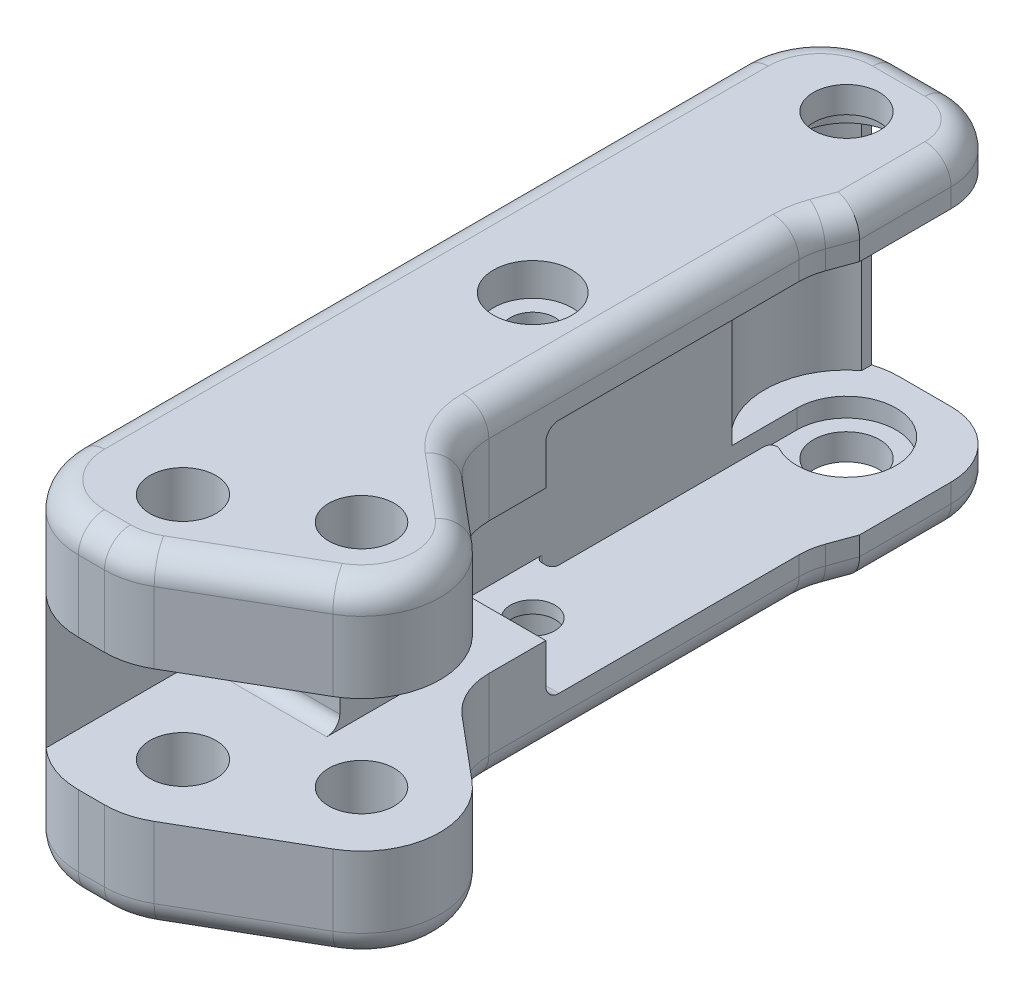
from build123d import *

# Parameters (mm, degrees)
EXTRUDE_1_DEPTH           = 7.45
EXTRUDE_2_DEPTH           = 3.45
SKETCH_3_W                = 26
SKETCH_3_H                = 4
CUT_EXTRUDE_1_DEPTH       = 9.8
SKETCH_4_W                = 4.2
SKETCH_4_H                = 62.754310162
EXTRUDE_3_DEPTH           = 5.05
CUT_EXTRUDE_2_DEPTH       = 1.45
SKETCH_6_W                = 7.8
SKETCH_6_H                = 4
EXTRUDE_4_DEPTH           = 5.05
SKETCH_7_W                = 9.8
SKETCH_7_H                = 4
CUT_EXTRUDE_3_DEPTH       = 9
CUT_EXTRUDE_4_DEPTH       = 9.05
CUT_EXTRUDE_5_REACH       = 63.678
SKETCH_10_W               = 5.05
SKETCH_10_H               = 12
SKETCH_11_W               = 14
SKETCH_11_H               = 5.05
CUT_EXTRUDE_6_DEPTH       = 2.2
HOLE_WIZARD_1_D           = 5.01
HOLE_WIZARD_2_D           = 5.05
HOLE_WIZARD_3_D           = 5.05
HOLE_WIZARD_4_D           = 3.4
HOLE_WIZARD_4_DEPTH       = 12.5
HOLE_WIZARD_4_CBORE_D     = 6
HOLE_WIZARD_4_CBORE_DEPTH = 2.5
FILLET_1_R                = 5
FILLET_2_R                = 6
FILLET_3_R                = 0.5
FILLET_4_R                = 1
FILLET_5_R                = 2


# Read off the part's stored shape, not the designer's step: 镜向2
with BuildPart() as part:
    # 草图1 → 凸台-拉伸1 (new body)
    with BuildSketch(Plane(origin=(0, 7.45, 0), x_dir=(1, 0, 0), z_dir=(0, 1, 0))):
        with BuildLine():
            Line((6, 15.064661918), (6, 56.754310162))
            Line((6, 56.754310162), (-8, 56.754310162))
            Line((-8, 56.754310162), (-8, -6))
            Line((-8, -6), (1.607695155, -6))
            Line((1.607695155, -6), (11.660254038, -0.196152423))
            ThreePointArc((11.660254038, -0.196152423), (14.637422226, 4.477065544), (12.516979696, 9.596266659))
            Line((12.516979696, 9.596266659), (6, 15.064661918))
        make_face()
    extrude(amount=-EXTRUDE_1_DEPTH)

    # 草图2 → 凸台-拉伸2 (add)
    with BuildSketch(Plane.XZ):
        Polygon((6, -42.006832742), (6, -56.754310162), (7, -56.754310162), (7, -44.754310162), align=None)
    extrude(amount=-EXTRUDE_2_DEPTH)

    # 草图3 → 切除-拉伸1 (cut)
    with BuildSketch(Plane(origin=(6, 0, 0), x_dir=(0, 0, -1), z_dir=(1, 0, 0))):
        with Locations((43.754310162, 5.45)):
            Rectangle(SKETCH_3_W, SKETCH_3_H)
    extrude(amount=-CUT_EXTRUDE_1_DEPTH, mode=Mode.SUBTRACT)

    # 草图4 → 凸台-拉伸3 (add)
    with BuildSketch(Plane(origin=(0, 7.45, 0), x_dir=(-1, 0, 0), z_dir=(0, 1, 0))):
        with Locations((5.9, -25.377155081)):
            Rectangle(SKETCH_4_W, SKETCH_4_H)
    extrude(amount=EXTRUDE_3_DEPTH)

    # 草图5 → 切除-拉伸2 (cut)
    with BuildSketch(Plane(origin=(0, 3.45, 0), x_dir=(-1, 0, 0), z_dir=(0, 1, 0))):
        with BuildLine():
            Line((3.8, -30.754310162), (2.5, -30.754310162))
            Line((2.5, -30.754310162), (2.5, -46.9477369))
            ThreePointArc((2.5, -46.9477369), (2.258573906, -47.375684951), (1.76744186, -47.390361698))
            ThreePointArc((1.76744186, -47.390361698), (-3.252405192, -52.719471851), (3.8, -50.754310162))
            Line((3.8, -50.754310162), (3.8, -30.754310162))
        make_face()
    extrude(amount=-CUT_EXTRUDE_2_DEPTH, mode=Mode.SUBTRACT)

    # 草图6 → 凸台-拉伸4 (add)
    with BuildSketch(Plane(origin=(0, 7.45, 0), x_dir=(-1, 0, 0), z_dir=(0, 1, 0))):
        with Locations((-0.1, -10)):
            Rectangle(SKETCH_6_W, SKETCH_6_H)
    extrude(amount=EXTRUDE_4_DEPTH)

    # 草图7 → 切除-拉伸3 (cut)
    with BuildSketch(Plane(origin=(0, 0, -30.754310162), x_dir=(-1, 0, 0), z_dir=(0, 0, -1))):
        with Locations((-1.1, 5.45)):
            Rectangle(SKETCH_7_W, SKETCH_7_H)
    extrude(amount=-CUT_EXTRUDE_3_DEPTH, mode=Mode.SUBTRACT)

    # 草图8 → 切除-拉伸4 (cut)
    with BuildSketch(Plane(origin=(0, 12.5, 0), x_dir=(-1, 0, 0), z_dir=(0, 1, 0))):
        with BuildLine():
            Line((3.8, -45.792203754), (3.8, -55.716416569))
            ThreePointArc((3.8, -55.716416569), (6.25, -50.754310162), (3.8, -45.792203754))
        make_face()
    extrude(amount=-CUT_EXTRUDE_4_DEPTH, mode=Mode.SUBTRACT)

    # 草图10 → 切除-拉伸5 (cut, up to next)
    with BuildSketch(Plane(origin=(-6, 0, 0), x_dir=(0, -1, 0), z_dir=(-1, 0, 0)), mode=Mode.PRIVATE) as cut_extrude_5_sk1:
        with Locations((-9.975, -18)):
            Rectangle(SKETCH_10_W, SKETCH_10_H)
    cut_extrude_5_tool1 = extrude(cut_extrude_5_sk1.sketch, amount=-CUT_EXTRUDE_5_REACH, mode=Mode.PRIVATE) & part.part
    add(cut_extrude_5_tool1.solids().sort_by_distance((-6, 9.975, -18))[0], mode=Mode.SUBTRACT)

    # 草图11 → 切除-拉伸6 (cut)
    with BuildSketch(Plane(origin=(-3.8, 0, 0), x_dir=(0, 0, -1), z_dir=(1, 0, 0))):
        with Locations((1, 9.975)):
            Rectangle(SKETCH_11_W, SKETCH_11_H)
    extrude(amount=-CUT_EXTRUDE_6_DEPTH, mode=Mode.SUBTRACT)

    # 孔1 (through all)
    with Locations(Plane(origin=(0, 7.45, 0), x_dir=(1, 0, 0), z_dir=(0, 1, 0))):
        with Locations((8.660254038, 5)):
            Hole(HOLE_WIZARD_1_D / 2)

    # 孔2 (through all)
    with Locations(Plane(origin=(0, 7.45, 0), x_dir=(1, 0, 0), z_dir=(0, 1, 0))):
        with Locations((0, 0)):
            Hole(HOLE_WIZARD_2_D / 2)

    # 孔3 (through all)
    with Locations(Plane(origin=(0, 2, 0), x_dir=(1, 0, 0), z_dir=(0, 1, 0))):
        with Locations((0, 50.754310162)):
            Hole(HOLE_WIZARD_3_D / 2)

    # 孔4
    with Locations(Plane(origin=(0, 0, 0), x_dir=(-1, 0, 0), z_dir=(0, -1, 0))):
        with Locations((0, 26.754310162)):
            CounterBoreHole(HOLE_WIZARD_4_D / 2, HOLE_WIZARD_4_CBORE_D / 2, HOLE_WIZARD_4_CBORE_DEPTH, depth=HOLE_WIZARD_4_DEPTH)

    # 圆角1
    fillet_1_edges = [part.edges().sort_by_distance(p)[0] for p in [
        (6, 3.725, -15.064661918),
        (6, 1.725, -42.006832742),
        (7, 1.725, -56.754310162),
    ]]
    fillet(fillet_1_edges, radius=FILLET_1_R)

    # 圆角2
    fillet_2_edges = [part.edges().sort_by_distance(p)[0] for p in [
        (-8, 6.25, -56.754310162),
        (-8, 6.25, 6),
        (1.607695155, 3.725, 6),
    ]]
    fillet(fillet_2_edges, radius=FILLET_2_R)

    # 圆角3
    fillet_3_edges = [part.edges().sort_by_distance(p)[0] for p in [
        (-2.5, 2.725, -30.754310162),
        (-3.8, 2.725, -30.754310162),
    ]]
    fillet(fillet_3_edges, radius=FILLET_3_R)

    # 圆角4
    fillet_4_edges = [part.edges().sort_by_distance(p)[0] for p in [
        (-4.9, 7.45, -24),
        (-1, 7.45, -8),
        (-1, 7.45, -12),
        (1.1, 3.45, -21.754310162),
    ]]
    fillet(fillet_4_edges, radius=FILLET_4_R)

    # 圆角5
    fillet_5_edges = [part.edges().sort_by_distance(p)[0] for p in [
        (6, 0, -29.260699024),
        (0, 0, -56.754310162),
        (7, 0, -48.254310162),
        (5.535533906, 0, -55.289844068),
        (6.075961235, 0, -41.993438727),
        (6.468461065, 0, -15.2831089),
        (-8, 0, -25.377155081),
        (7.330127019, 0, 2.696152423),
        (-1, 0, 6),
        (1.552914271, 0, 5.795554958),
        (-6.242640687, 0, 4.242640687),
        (-6.242640687, 0, -54.996950849),
        (6.650768448, 0, -43.794804359),
        (14.637422226, 0, -4.477065544),
        (10.151520824, 0, -11.581122326),
    ]]
    fillet(fillet_5_edges, radius=FILLET_5_R)

    # 镜向2: part across plane


with BuildPart() as part_1:
    add(part.part)
    add(part.part.mirror(Plane.ZX.offset(12.5)))


solid = part_1.part
